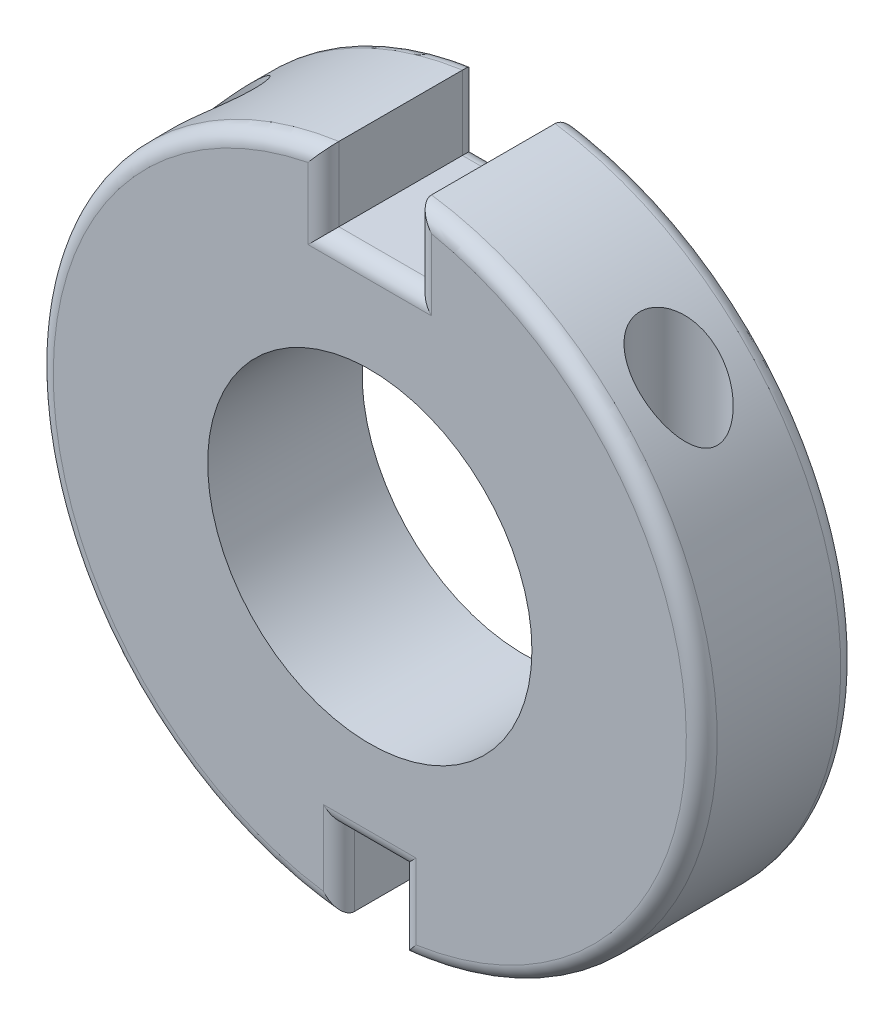
from build123d import *

# Parameters (mm, degrees)
ESQUISSE1_R                  = 10.5
BOSS_EXTRU_1_DEPTH           = 10
ENL_V_MAT_EXTRU_1_DEPTH      = 20
ENL_V_MAT_EXTRU_1_DEPTH_BACK = 12.5
ESQUISSE2_R                  = 1.25
ENL_V_START                  = 7.5
ESQUISSE2_5_R                = 2.5
ESQUISSE2_5_R_2              = 1.25
ENL_V_MAT_EXTRU_2_DEPTH      = 10
CONG_1_R                     = 1


with BuildPart() as part:
    # Esquisse1 → Boss.-Extru.1 (new body)
    with BuildSketch(Plane.XY):
        with BuildLine():
            Line((-2, -16.406774629), (2, -16.406774629))
            Line((2, -16.406774629), (2, -21.406774629))
            ThreePointArc((2, -21.406774629), (21.494105507, -0.503416766), (3, 21.289668856))
            Line((3, 21.289668856), (3, 16.5))
            Line((3, 16.5), (-3, 16.5))
            Line((-3, 16.5), (-3, 21.289668856))
            ThreePointArc((-3, 21.289668856), (-21.494105507, -0.503416766), (-2, -21.406774629))
            Line((-2, -21.406774629), (-2, -16.406774629))
        make_face()
        Circle(ESQUISSE1_R, mode=Mode.SUBTRACT)
    extrude(amount=BOSS_EXTRU_1_DEPTH)

    # Esquisse2 → Enlèv. mat.-Extru.1 (cut, two sides: drawn at the far end of the back side and taken through both)
    with BuildSketch(Plane(origin=(0, 0, 0), x_dir=(1, 0, 0), z_dir=(0, 1, 0)).offset(-ENL_V_MAT_EXTRU_1_DEPTH_BACK)):
        with Locations((15, -5)):
            Circle(ESQUISSE2_R)
        with Locations((-15, -5)):
            Circle(ESQUISSE2_R)
    extrude(amount=ENL_V_MAT_EXTRU_1_DEPTH + ENL_V_MAT_EXTRU_1_DEPTH_BACK, mode=Mode.SUBTRACT)

    # Esquisse2<5> → Enlèv. mat.-Extru.2 (cut)
    # profile 1 of 2: a face of its own
    with BuildSketch(Plane(origin=(0, 0, 0), x_dir=(1, 0, 0), z_dir=(0, 1, 0)).offset(ENL_V_START)):
        with Locations((15, -5)):
            Circle(ESQUISSE2_5_R)
        with Locations((15, -5)):
            Circle(ESQUISSE2_5_R_2, mode=Mode.SUBTRACT)
    # profile 2 of 2: a face of its own
    with BuildSketch(Plane(origin=(0, 0, 0), x_dir=(1, 0, 0), z_dir=(0, 1, 0)).offset(ENL_V_START)):
        with Locations((-15, -5)):
            Circle(ESQUISSE2_5_R)
        with Locations((-15, -5)):
            Circle(ESQUISSE2_5_R_2, mode=Mode.SUBTRACT)
    extrude(amount=ENL_V_MAT_EXTRU_2_DEPTH, mode=Mode.SUBTRACT)

    # Congé1
    cong_1_edges = [part.edges().sort_by_distance(p)[0] for p in [
        (-2, -18.906774629, 0),
        (0, -16.406774629, 0),
        (2, -18.906774629, 0),
        (-21.494105507, -0.503416766, 0),
        (-3, 18.894834428, 0),
        (0, 16.5, 0),
        (3, 18.894834428, 0),
        (21.494105507, -0.503416766, 0),
        (-2, -18.906774629, 10),
        (0, -16.406774629, 10),
        (2, -18.906774629, 10),
        (-3, 18.894834428, 10),
        (0, 16.5, 10),
        (3, 18.894834428, 10),
        (21.494105507, -0.503416766, 10),
        (-21.494105507, -0.503416766, 10),
    ]]
    fillet(cong_1_edges, radius=CONG_1_R)


solid = part.part
